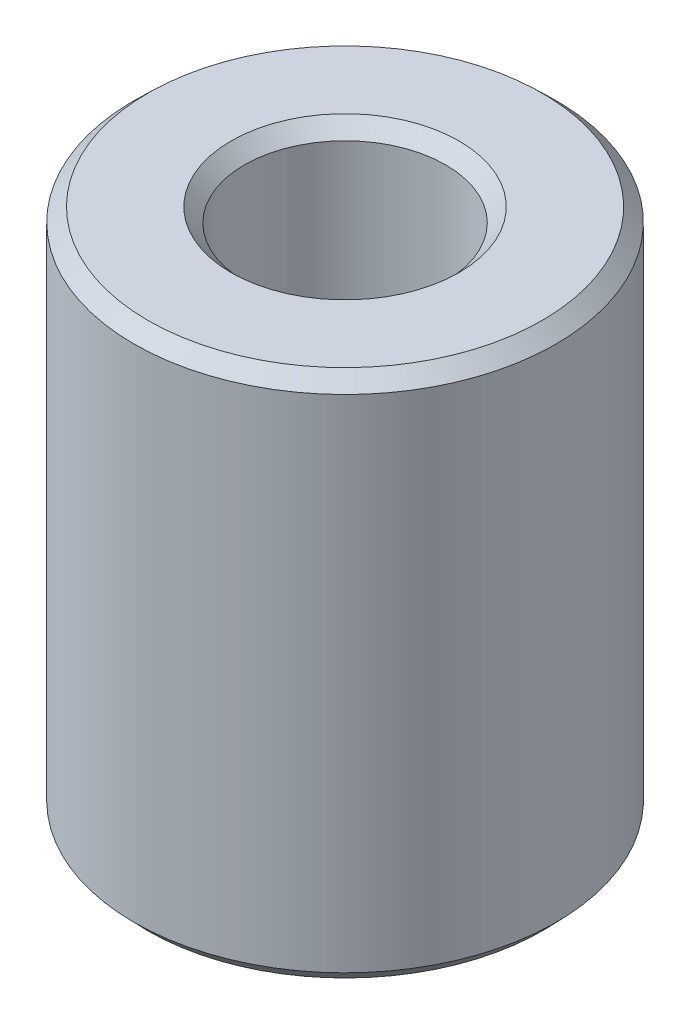
from build123d import *
from OCP.BRepFilletAPI import BRepFilletAPI_MakeChamfer

# Parameters (mm, degrees)
SKETCH1_R           = 57.5
BOSS_EXTRUDE1_DEPTH = 143.973495212
SKETCH2_R           = 27.417234978
CUT_EXTRUDE1_DEPTH  = 166.350740318
CHAMFER1_SIZE       = 3.659465922
CHAMFER1_SIZE2      = 3.804435001


with BuildPart() as part:
    # Sketch1 → Boss-Extrude1 (new body)
    with BuildSketch(Plane(origin=(0, 0, 0), x_dir=(1, 0, 0), z_dir=(0, 1, 0))):
        Circle(SKETCH1_R)
    extrude(amount=BOSS_EXTRUDE1_DEPTH)

    # Sketch2 → Cut-Extrude1 (cut, through all)
    with BuildSketch(Plane(origin=(0, 0, 0), x_dir=(1, 0, 0), z_dir=(0, 1, 0))):
        Circle(SKETCH2_R)
    extrude(amount=CUT_EXTRUDE1_DEPTH, mode=Mode.SUBTRACT)

    # Chamfer1: one chamfer whose edges measure the first distance from different faces: ONE call of the kernel's chamfer builder (chamfer() names one face for all edges)
    chamfer1_edges_1 = [part.edges().sort_by_distance(p)[0] for p in [
        (-27.417234978, 143.973495212, 0),
    ]]
    chamfer1_side_1 = [part.faces().sort_by_distance(p)[0] for p in [
        (-55.873654403, 143.973495212, 0),
    ]]
    chamfer1_edges_2 = [part.edges().sort_by_distance(p)[0] for p in [
        (-27.417234978, 0, 0),
    ]]
    chamfer1_side_2 = [part.faces().sort_by_distance(p)[0] for p in [
        (-27.417234978, 71.986747606, 0),
    ]]
    chamfer1_edges_3 = [part.edges().sort_by_distance(p)[0] for p in [
        (-57.5, 0, 0),
    ]]
    chamfer1_side_3 = [part.faces().sort_by_distance(p)[0] for p in [
        (-55.873654403, 0, 0),
    ]]
    chamfer1_edges_4 = [part.edges().sort_by_distance(p)[0] for p in [
        (-57.5, 143.973495212, 0),
    ]]
    chamfer1_side_4 = [part.faces().sort_by_distance(p)[0] for p in [
        (-57.5, 71.986747606, 0),
    ]]
    chamfer1 = BRepFilletAPI_MakeChamfer(part.part.solid().wrapped)
    for e in chamfer1_edges_1:
        chamfer1.Add(CHAMFER1_SIZE, CHAMFER1_SIZE2, e.wrapped, chamfer1_side_1[0].wrapped)  # the first distance lies on this face
    for e in chamfer1_edges_2:
        chamfer1.Add(CHAMFER1_SIZE, CHAMFER1_SIZE2, e.wrapped, chamfer1_side_2[0].wrapped)  # the first distance lies on this face
    for e in chamfer1_edges_3:
        chamfer1.Add(CHAMFER1_SIZE, CHAMFER1_SIZE2, e.wrapped, chamfer1_side_3[0].wrapped)  # the first distance lies on this face
    for e in chamfer1_edges_4:
        chamfer1.Add(CHAMFER1_SIZE, CHAMFER1_SIZE2, e.wrapped, chamfer1_side_4[0].wrapped)  # the first distance lies on this face
    add(Compound.cast(chamfer1.Shape()), mode=Mode.REPLACE)


solid = part.part
